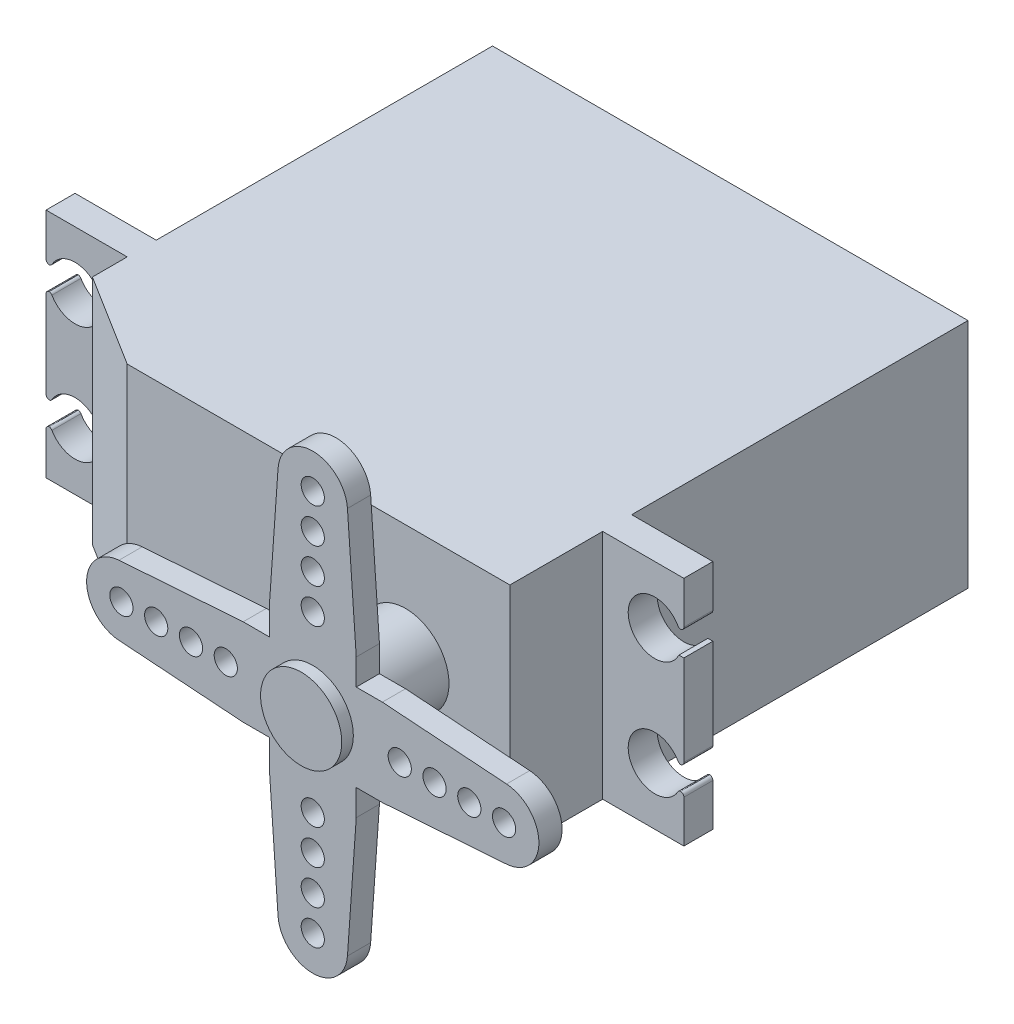
from build123d import *

# Parameters (mm, degrees)
BOSS_EXTRUDE1_DEPTH = 39.5
CHAMFER1_SIZE       = 5
CHAMFER1_SIZE2      = 8
SKETCH2_W           = 7.0000000000000036
SKETCH2_H           = 20
SKETCH2_W_2         = 7
BOSS_EXTRUDE2_DEPTH = 2.5
CUT_EXTRUDE1_REACH  = 44.994
FILLET1_R           = 0.3
SKETCH4_R           = 3.7499999999999996
BOSS_EXTRUDE3_DEPTH = 8
BOSS_EXTRUDE4_START = -2
SKETCH5_R           = 0.9999999999999998
SKETCH5_R_2         = 1.0000000000000016
BOSS_EXTRUDE4_DEPTH = 2
SKETCH6_R           = 3.5
BOSS_EXTRUDE5_DEPTH = 1
FILLET2_R           = 0.3
CUT_EXTRUDE2_REACH  = 61.979
SKETCH7_R           = 0.9999999999999996
SKETCH7_R_2         = 1.0000000000000013
SKETCH7_R_3         = 1.0000000000000016
SKETCH7_R_4         = 0.9999999999999998
SKETCH7_R_5         = 1.0000000000000002


with BuildPart() as part:
    # Sketch1 → Boss-Extrude1 (new body)
    with BuildSketch(Plane.XY):
        Polygon((-20.5, 9.999999999999996), (20.5, 9.999999999999998), (20.499999999999996, -10.000000000000004), (-20.499999999999996, -10.000000000000004), align=None)
    extrude(amount=BOSS_EXTRUDE1_DEPTH)

    # Chamfer1
    chamfer1_edges = [part.edges().sort_by_distance(p)[0] for p in [
        (-20.5, -3.55e-15, 39.5),
    ]]
    chamfer1_side = [part.faces().sort_by_distance(p)[0] for p in [
        (-20.5, -3.57e-15, 19.75),
    ]]
    chamfer(chamfer1_edges, length=CHAMFER1_SIZE, length2=CHAMFER1_SIZE2, reference=chamfer1_side[0])

    # Sketch2 → Boss-Extrude2 (add)
    with BuildSketch(Plane.XY.offset(31.5)):
        with Locations((24, -2.66e-15)):
            Rectangle(SKETCH2_W, SKETCH2_H)
        with Locations((-24.000000000000004, -3.55e-15)):
            Rectangle(SKETCH2_W_2, SKETCH2_H)
    extrude(amount=-BOSS_EXTRUDE2_DEPTH)

    # Sketch3 → Cut-Extrude1 (cut, up to next)
    with BuildSketch(Plane.XY.offset(31.5), mode=Mode.PRIVATE) as cut_extrude1_sk1:
        with BuildLine():
            Line((-25.000000000000004, -7.349999999999999), (-25.000000000000004, -2.749999999999999))
            ThreePointArc((-24.999999999999925, -2.7499999999999996), (-26.22270192606372, -3.1019240261221634), (-27.0712315177208, -4.05))
            Line((-27.0712315177208, -4.050000000000002), (-27.5, -4.05))
            Line((-27.5, -4.05), (-27.5, -6.050000000000002))
            Line((-27.5, -6.050000000000002), (-27.071231517720797, -6.050000000000002))
            ThreePointArc((-27.071231517720797, -6.050000000000001), (-26.222701926063746, -6.998075973877809), (-25.000000000000004, -7.349999999999987))
        make_face()
    cut_extrude1_tool1 = extrude(cut_extrude1_sk1.sketch, amount=-CUT_EXTRUDE1_REACH, mode=Mode.PRIVATE) & part.part
    # Sketch3 → Cut-Extrude1 (cut, up to next)
    with BuildSketch(Plane.XY.offset(31.5), mode=Mode.PRIVATE) as cut_extrude1_sk2:
        with BuildLine():
            Line((-25.000000000000004, 2.750000000000001), (-25.000000000000004, 7.3500000000000005))
            ThreePointArc((-25, 7.3500000000000005), (-26.22270192606375, 6.9980759738778175), (-27.0712315177208, 6.0500000000000025))
            Line((-27.0712315177208, 6.050000000000002), (-27.5, 6.050000000000001))
            Line((-27.5, 6.050000000000001), (-27.5, 4.050000000000001))
            Line((-27.5, 4.050000000000001), (-27.0712315177208, 4.050000000000001))
            ThreePointArc((-27.0712315177208, 4.050000000000001), (-26.22270192606372, 3.1019240261221657), (-24.99999999999993, 2.7500000000000013))
        make_face()
    cut_extrude1_tool2 = extrude(cut_extrude1_sk2.sketch, amount=-CUT_EXTRUDE1_REACH, mode=Mode.PRIVATE) & part.part
    # Sketch3 → Cut-Extrude1 (cut, up to next)
    with BuildSketch(Plane.XY.offset(31.5), mode=Mode.PRIVATE) as cut_extrude1_sk3:
        with BuildLine():
            ThreePointArc((-24.99999999999993, 2.7500000000000013), (-22.700000000000003, 5.050000000000038), (-25, 7.3500000000000005))
            Line((-25.000000000000004, 7.3500000000000005), (-25.000000000000004, 2.750000000000001))
        make_face()
    cut_extrude1_tool3 = extrude(cut_extrude1_sk3.sketch, amount=-CUT_EXTRUDE1_REACH, mode=Mode.PRIVATE) & part.part
    # Sketch3 → Cut-Extrude1 (cut, up to next)
    with BuildSketch(Plane.XY.offset(31.5), mode=Mode.PRIVATE) as cut_extrude1_sk4:
        with BuildLine():
            ThreePointArc((-25.000000000000004, -7.349999999999987), (-22.700000000000014, -5.050000000000032), (-24.999999999999925, -2.7499999999999996))
            Line((-25.000000000000004, -2.749999999999999), (-25.000000000000004, -7.349999999999999))
        make_face()
    cut_extrude1_tool4 = extrude(cut_extrude1_sk4.sketch, amount=-CUT_EXTRUDE1_REACH, mode=Mode.PRIVATE) & part.part
    cut_extrude1_1 = cut_extrude1_tool1.solids().sort_by_distance((-26.061612, -5.05, 31.5))[0]
    add(cut_extrude1_1, mode=Mode.SUBTRACT)
    cut_extrude1_2 = cut_extrude1_tool2.solids().sort_by_distance((-26.061612, 5.05, 31.5))[0]
    add(cut_extrude1_2, mode=Mode.SUBTRACT)
    cut_extrude1_3 = cut_extrude1_tool3.solids().sort_by_distance((-24.02385, 5.05, 31.5))[0]
    add(cut_extrude1_3, mode=Mode.SUBTRACT)
    cut_extrude1_4 = cut_extrude1_tool4.solids().sort_by_distance((-24.02385, -5.05, 31.5))[0]
    add(cut_extrude1_4, mode=Mode.SUBTRACT)
    cut_extrude1 = cut_extrude1_1 + cut_extrude1_2 + cut_extrude1_3 + cut_extrude1_4  # Cut-Extrude1 as one shape, for the pattern or mirror that repeats it

    # Fillet1
    # the kernel refuses this fillet: 0.3 mm, written as the material it takes off along each edge
    with BuildSketch(Plane(origin=(-27.5, -6.050000000000001, 32.25), x_dir=(0, -1, 0), z_dir=(0, 0, -1))) as fillet1_piece_1:
        with BuildLine():
            CenterArc((FILLET1_R, -FILLET1_R), FILLET1_R, 90, 90)
            Line((8.9e-16, -FILLET1_R), (0, 0))
            Line((0, 0), (FILLET1_R, 0))
        make_face()
    extrude(amount=4, mode=Mode.SUBTRACT)
    with BuildSketch(Plane(origin=(-27.071231517720797, -6.050000000000002, 31.951086330296846), x_dir=(-1, 0, 0), z_dir=(0, 0, -1))) as fillet1_piece_2:
        with BuildLine():
            CenterArc((0.1804345321187384, -0.2999999999999998), FILLET1_R, 90, 59.99999999999969)
            ThreePointArc((-0.07937308901659179, -0.14999999999999858), (-0.03830260155452336, -0.07573231884842269), (0, 0))
            Line((0, 0), (0.1804345321187384, 0))
        make_face()
    extrude(amount=3.402172660593692, mode=Mode.SUBTRACT)
    with BuildSketch(Plane(origin=(-27.5, -4.05, 32.25), x_dir=(1, -2.96e-15, 0), z_dir=(0, 0, -1))) as fillet1_piece_3:
        with BuildLine():
            CenterArc((FILLET1_R, -FILLET1_R), FILLET1_R, 89.99999999999983, 90.00000000000017)
            Line((-4.44e-15, -FILLET1_R), (0, 0))
            Line((0, 0), (FILLET1_R, 0))
        make_face()
    extrude(amount=4, mode=Mode.SUBTRACT)
    with BuildSketch(Plane(origin=(-27.071231517720804, -4.050000000000002, 31.951086330296864), x_dir=(0.4677097038471302, 0.8838821374636041, 0), z_dir=(0, 0, -1))) as fillet1_piece_4:
        with BuildLine():
            CenterArc((0.1807736596580287, -0.2997957710755019), FILLET1_R, 92.11426912972495, 59.99999999999976)
            Line((-0.08439098158105073, -0.1594828599213598), (0, 0))
            ThreePointArc((0, 0), (0.08485294228846127, -0.00156575508782813), (0.16970588457692368, -1e-17))
        make_face()
    extrude(amount=3.4021726605937275, mode=Mode.SUBTRACT)
    with BuildSketch(Plane(origin=(-27.5, 6.050000000000001, 32.25), x_dir=(0, 1, 0), z_dir=(0, 0, -1))) as fillet1_piece_5:
        with BuildLine():
            CenterArc((FILLET1_R, FILLET1_R), FILLET1_R, 180, 90)
            Line((8.9e-16, FILLET1_R), (0, 0))
            Line((0, 0), (FILLET1_R, 0))
        make_face()
    extrude(amount=4, mode=Mode.SUBTRACT)
    with BuildSketch(Plane(origin=(-27.0712315177208, 6.050000000000002, 31.951086330296864), x_dir=(0.467709703847141, 0.8838821374635986, 0), z_dir=(0, 0, -1))) as fillet1_piece_6:
        with BuildLine():
            CenterArc((0.18077365965802517, -0.2997957710755002), FILLET1_R, 92.11426912972502, 60.00000000000034)
            Line((-0.0843909815810559, -0.1594828599213611), (0, 0))
            ThreePointArc((0, 0), (0.08485294228846048, -0.00156575508782875), (0.16970588457691976, 1e-17))
        make_face()
    extrude(amount=3.4021726605937275, mode=Mode.SUBTRACT)
    with BuildSketch(Plane(origin=(-27.5, 4.050000000000001, 32.25), x_dir=(0, -1, 0), z_dir=(0, 0, -1))) as fillet1_piece_7:
        with BuildLine():
            CenterArc((FILLET1_R, -FILLET1_R), FILLET1_R, 90, 90)
            Line((0, -FILLET1_R), (0, 0))
            Line((0, 0), (FILLET1_R, 0))
        make_face()
    extrude(amount=4, mode=Mode.SUBTRACT)
    with BuildSketch(Plane(origin=(-27.071231517720808, 4.050000000000001, 31.951086330296874), x_dir=(-1, 0, 0), z_dir=(0, 0, -1))) as fillet1_piece_8:
        with BuildLine():
            CenterArc((0.1804345321187455, -0.2999999999999998), FILLET1_R, 90, 60.00000000000051)
            ThreePointArc((-0.07937308901658824, -0.1500000000000017), (-0.03830260155451981, -0.07573231884842668), (0, 0))
            Line((0, 0), (0.1804345321187455, 0))
        make_face()
    extrude(amount=3.402172660593749, mode=Mode.SUBTRACT)

    # Mirror1: Cut-Extrude1 across plane
    add(cut_extrude1.mirror(Plane(origin=(0, 0, 0), x_dir=(0, 0, 1), z_dir=(1, 0, 0))), mode=Mode.SUBTRACT)

    # Sketch4 → Boss-Extrude3 (add)
    with BuildSketch(Plane.XY.offset(39.5)):
        with Locations((11.500000000000002, 0)):
            Circle(SKETCH4_R)
    extrude(amount=BOSS_EXTRUDE3_DEPTH)

    # Sketch5 → Boss-Extrude4 (add)
    # profile 1 of 10: a face of its own
    with BuildSketch(Plane.XY.offset(47.5).offset(BOSS_EXTRUDE4_START)):
        with BuildLine():
            Line((11.500000000000002, 15.5), (11.500000000000002, 3.75))
            Line((11.500000000000002, 3.75), (15.250000000000002, 3.75))
            Line((15.250000000000002, 3.75), (15.250000000000002, 6.000000000000001))
            Line((15.250000000000002, 6), (14.492527079898673, 16.711616814249528))
            ThreePointArc((14.492527079898675, 16.711616814249528), (13.545134415784378, 18.694863371915048), (11.500000000000002, 19.5))
            Line((11.500000000000002, 19.5), (11.500000000000002, 17.5))
            ThreePointArc((11.500000000000034, 17.5), (12.20710678118656, 17.207106781186535), (12.500000000000002, 16.5))
            ThreePointArc((12.500000000000002, 16.5), (12.207106781186539, 15.792893218813441), (11.499999999999972, 15.5))
        make_face()
    # profile 2 of 10: a face of its own
    with BuildSketch(Plane.XY.offset(47.5).offset(BOSS_EXTRUDE4_START)):
        with BuildLine():
            Line((7.750000000000002, 3.7499999999999996), (11.500000000000002, 3.75))
            Line((11.500000000000002, 3.75), (11.500000000000002, 15.5))
            ThreePointArc((11.499999999999972, 15.5), (10.500000000000002, 16.500000000000032), (11.500000000000034, 17.5))
            Line((11.500000000000002, 17.5), (11.500000000000002, 19.5))
            ThreePointArc((11.500000000000002, 19.5), (9.454865584215625, 18.694863371915048), (8.507472920101328, 16.711616814249528))
            Line((8.50747292010133, 16.711616814249528), (7.750000000000002, 6))
            Line((7.750000000000002, 5.999999999999999), (7.750000000000002, 3.7499999999999996))
        make_face()
    # profile 3 of 10: a face of its own
    with BuildSketch(Plane.XY.offset(47.5).offset(BOSS_EXTRUDE4_START)):
        with BuildLine():
            Line((7.750000000000002, 0), (7.750000000000002, 3.7499999999999996))
            Line((7.750000000000002, 3.7499999999999996), (5.500000000000002, 3.749999999999999))
            Line((5.500000000000002, 3.749999999999999), (-5.211616814249522, 2.9925270798986716))
            ThreePointArc((-5.211616814249523, 2.9925270798986716), (-7.9999999999999964, -1.4e-16), (-5.211616814249525, -2.9925270798986743))
            Line((-5.211616814249524, -2.992527079898674), (5.500000000000002, -3.75))
            Line((5.500000000000002, -3.75), (7.750000000000003, -3.75))
            Line((7.750000000000003, -3.75), (7.750000000000002, 0))
        make_face()
        with Locations((-4.999999999999997, 0)):
            Circle(SKETCH5_R, mode=Mode.SUBTRACT)
    # profile 4 of 10: a face of its own
    with BuildSketch(Plane.XY.offset(47.5).offset(BOSS_EXTRUDE4_START)):
        with BuildLine():
            Line((17.5, 3.75), (15.250000000000002, 3.75))
            Line((15.250000000000002, 3.75), (15.250000000000002, 0))
            Line((15.250000000000002, 0), (15.250000000000002, -3.75))
            Line((15.250000000000002, -3.75), (17.5, -3.75))
            Line((17.5, -3.75), (28.21161681424953, -2.9925270798986747))
            ThreePointArc((28.21161681424953, -2.9925270798986743), (31.000000000000007, 1.1e-16), (28.21161681424953, 2.9925270798986756))
            Line((28.21161681424953, 2.9925270798986747), (17.5, 3.75))
        make_face()
        with Locations((28.000000000000004, 0)):
            Circle(SKETCH5_R_2, mode=Mode.SUBTRACT)
    # profile 5 of 10: a face of its own
    with BuildSketch(Plane.XY.offset(47.5).offset(BOSS_EXTRUDE4_START)):
        with BuildLine():
            Line((15.250000000000002, -3.75), (11.500000000000002, -3.75))
            Line((11.500000000000002, -3.75), (11.500000000000002, -15.5))
            ThreePointArc((11.500000000000034, -15.5), (12.20710678118656, -15.792893218813465), (12.500000000000002, -16.5))
            ThreePointArc((12.500000000000002, -16.5), (12.207106781186539, -17.207106781186557), (11.499999999999972, -17.5))
            Line((11.500000000000002, -17.5), (11.500000000000002, -19.5))
            ThreePointArc((11.500000000000002, -19.5), (13.545134415784378, -18.694863371915048), (14.492527079898677, -16.711616814249528))
            Line((14.492527079898675, -16.711616814249528), (15.250000000000002, -6))
            Line((15.250000000000002, -5.999999999999999), (15.250000000000002, -3.75))
        make_face()
    # profile 6 of 10: a face of its own
    with BuildSketch(Plane.XY.offset(47.5).offset(BOSS_EXTRUDE4_START)):
        with BuildLine():
            Line((11.500000000000002, -15.5), (11.500000000000002, -3.75))
            Line((11.500000000000002, -3.75), (7.750000000000003, -3.75))
            Line((7.750000000000003, -3.75), (7.750000000000003, -6.000000000000001))
            Line((7.750000000000003, -6), (8.507472920101327, -16.711616814249528))
            ThreePointArc((8.507472920101327, -16.711616814249528), (9.454865584215623, -18.694863371915048), (11.500000000000002, -19.5))
            Line((11.500000000000002, -19.5), (11.500000000000002, -17.5))
            ThreePointArc((11.499999999999972, -17.5), (10.500000000000002, -16.499999999999968), (11.500000000000034, -15.5))
        make_face()
    # profile 7 of 10: a face of its own
    with BuildSketch(Plane.XY.offset(47.5).offset(BOSS_EXTRUDE4_START)):
        with BuildLine():
            Line((7.750000000000003, -3.75), (11.500000000000002, -3.75))
            ThreePointArc((11.500000000000002, -3.7499999999999996), (8.848349570550448, -2.651650429449553), (7.750000000000002, 4.6e-16))
            Line((7.750000000000002, 0), (7.750000000000003, -3.75))
        make_face()
    # profile 8 of 10: a face of its own
    with BuildSketch(Plane.XY.offset(47.5).offset(BOSS_EXTRUDE4_START)):
        with BuildLine():
            ThreePointArc((7.750000000000002, 4.6e-16), (8.848349570550448, 2.651650429449553), (11.500000000000002, 3.7499999999999996))
            Line((11.500000000000002, 3.75), (7.750000000000002, 3.7499999999999996))
            Line((7.750000000000002, 3.7499999999999996), (7.750000000000002, 0))
        make_face()
    # profile 9 of 10: a face of its own
    with BuildSketch(Plane.XY.offset(47.5).offset(BOSS_EXTRUDE4_START)):
        with BuildLine():
            Line((15.250000000000002, 3.75), (11.500000000000002, 3.75))
            ThreePointArc((11.500000000000002, 3.7499999999999996), (14.151650429449555, 2.651650429449553), (15.250000000000002, 0))
            Line((15.250000000000002, 0), (15.250000000000002, 3.75))
        make_face()
    # profile 10 of 10: a face of its own
    with BuildSketch(Plane.XY.offset(47.5).offset(BOSS_EXTRUDE4_START)):
        with BuildLine():
            ThreePointArc((15.250000000000002, -9.2e-16), (14.151650429449553, -2.6516504294495533), (11.500000000000002, -3.7499999999999996))
            Line((11.500000000000002, -3.75), (15.250000000000002, -3.75))
            Line((15.250000000000002, -3.75), (15.250000000000002, 0))
        make_face()
    extrude(amount=BOSS_EXTRUDE4_DEPTH)

    # Sketch6 → Boss-Extrude5 (add)
    with BuildSketch(Plane.XY.offset(47.5)):
        with Locations((11.500000000000002, 0)):
            Circle(SKETCH6_R)
    extrude(amount=BOSS_EXTRUDE5_DEPTH)

    # Fillet2
    # the kernel refuses this fillet: 0.3 mm, written as the material it takes off along each edge
    with BuildSketch(Plane(origin=(27.071231517720797, -6.050000000000002, 31.951086330296846), x_dir=(1, 0, 0), z_dir=(0, 0, -1))) as fillet2_piece_1:
        with BuildLine():
            CenterArc((0.1804345321187384, 0.2999999999999998), FILLET2_R, 210.0000000000003, 59.99999999999966)
            ThreePointArc((-0.07937308901659179, 0.14999999999999858), (-0.03830260155452336, 0.07573231884842269), (0, 0))
            Line((0, 0), (0.1804345321187384, 0))
        make_face()
    extrude(amount=3.402172660593692, mode=Mode.SUBTRACT)
    with BuildSketch(Plane(origin=(27.500000000000004, -6.0500000000000025, 32.25000000000001), x_dir=(0, -1, 0), z_dir=(0, 0, -1))) as fillet2_piece_2:
        with BuildLine():
            CenterArc((FILLET2_R, FILLET2_R), FILLET2_R, 180, 90)
            Line((8.9e-16, FILLET2_R), (0, 0))
            Line((0, 0), (FILLET2_R, 0))
        make_face()
    extrude(amount=4.000000000000011, mode=Mode.SUBTRACT)
    with BuildSketch(Plane(origin=(27.071231517720804, -4.050000000000002, 31.951086330296864), x_dir=(-0.4677097038471302, 0.8838821374636041, 0), z_dir=(0, 0, -1))) as fillet2_piece_3:
        with BuildLine():
            CenterArc((0.1807736596580287, 0.2997957710755019), FILLET2_R, 207.8857308702753, 59.99999999999977)
            Line((-0.08439098158105073, 0.1594828599213598), (0, 0))
            ThreePointArc((0, 0), (0.08485294228846127, 0.00156575508782813), (0.16970588457692368, 1e-17))
        make_face()
    extrude(amount=3.4021726605937275, mode=Mode.SUBTRACT)
    with BuildSketch(Plane(origin=(27.500000000000004, -4.05, 32.24999999999999), x_dir=(-1, -2.96e-15, 0), z_dir=(0, 0, -1))) as fillet2_piece_4:
        with BuildLine():
            CenterArc((FILLET2_R, FILLET2_R), FILLET2_R, 180.00000000000034, 89.99999999999983)
            Line((-4.44e-15, FILLET2_R), (0, 0))
            Line((0, 0), (FILLET2_R, 0))
        make_face()
    extrude(amount=3.9999999999999893, mode=Mode.SUBTRACT)
    with BuildSketch(Plane(origin=(27.500000000000004, 6.050000000000001, 32.25), x_dir=(0, 1, 0), z_dir=(0, 0, -1))) as fillet2_piece_5:
        with BuildLine():
            CenterArc((FILLET2_R, -FILLET2_R), FILLET2_R, 90, 90)
            Line((8.9e-16, -FILLET2_R), (0, 0))
            Line((0, 0), (FILLET2_R, 0))
        make_face()
    extrude(amount=4, mode=Mode.SUBTRACT)
    with BuildSketch(Plane(origin=(27.0712315177208, 6.050000000000002, 31.951086330296864), x_dir=(-0.467709703847141, 0.8838821374635986, 0), z_dir=(0, 0, -1))) as fillet2_piece_6:
        with BuildLine():
            CenterArc((0.18077365965802517, 0.2997957710755002), FILLET2_R, 207.88573087027464, 60.00000000000034)
            Line((-0.0843909815810559, 0.1594828599213611), (0, 0))
            ThreePointArc((0, 0), (0.08485294228846048, 0.00156575508782875), (0.16970588457691976, -1e-17))
        make_face()
    extrude(amount=3.4021726605937275, mode=Mode.SUBTRACT)

    # Sketch7 → Cut-Extrude2 (cut, up to next)
    with BuildSketch(Plane.XY.offset(47.5), mode=Mode.PRIVATE) as cut_extrude2_sk1:
        with Locations((11.500000000000002, 13.500000000000002)):
            Circle(SKETCH7_R)
    cut_extrude2_tool1 = extrude(cut_extrude2_sk1.sketch, amount=-CUT_EXTRUDE2_REACH, mode=Mode.PRIVATE) & part.part
    # Sketch7 → Cut-Extrude2 (cut, up to next)
    with BuildSketch(Plane.XY.offset(47.5), mode=Mode.PRIVATE) as cut_extrude2_sk2:
        with Locations((11.500000000000002, 10.500000000000002)):
            Circle(SKETCH7_R)
    cut_extrude2_tool2 = extrude(cut_extrude2_sk2.sketch, amount=-CUT_EXTRUDE2_REACH, mode=Mode.PRIVATE) & part.part
    # Sketch7 → Cut-Extrude2 (cut, up to next)
    with BuildSketch(Plane.XY.offset(47.5), mode=Mode.PRIVATE) as cut_extrude2_sk3:
        with Locations((11.5, 7.5000000000000036)):
            Circle(SKETCH7_R_2)
    cut_extrude2_tool3 = extrude(cut_extrude2_sk3.sketch, amount=-CUT_EXTRUDE2_REACH, mode=Mode.PRIVATE) & part.part
    # Sketch7 → Cut-Extrude2 (cut, up to next)
    with BuildSketch(Plane.XY.offset(47.5), mode=Mode.PRIVATE) as cut_extrude2_sk4:
        with Locations((25.000000000000004, 0)):
            Circle(SKETCH7_R_3)
    cut_extrude2_tool4 = extrude(cut_extrude2_sk4.sketch, amount=-CUT_EXTRUDE2_REACH, mode=Mode.PRIVATE) & part.part
    # Sketch7 → Cut-Extrude2 (cut, up to next)
    with BuildSketch(Plane.XY.offset(47.5), mode=Mode.PRIVATE) as cut_extrude2_sk5:
        with Locations((22.000000000000007, 0)):
            Circle(SKETCH7_R_3)
    cut_extrude2_tool5 = extrude(cut_extrude2_sk5.sketch, amount=-CUT_EXTRUDE2_REACH, mode=Mode.PRIVATE) & part.part
    # Sketch7 → Cut-Extrude2 (cut, up to next)
    with BuildSketch(Plane.XY.offset(47.5), mode=Mode.PRIVATE) as cut_extrude2_sk6:
        with Locations((19.000000000000007, 0)):
            Circle(SKETCH7_R_3)
    cut_extrude2_tool6 = extrude(cut_extrude2_sk6.sketch, amount=-CUT_EXTRUDE2_REACH, mode=Mode.PRIVATE) & part.part
    # Sketch7 → Cut-Extrude2 (cut, up to next)
    with BuildSketch(Plane.XY.offset(47.5), mode=Mode.PRIVATE) as cut_extrude2_sk7:
        with Locations((11.500000000000005, -7.500000000000003)):
            Circle(SKETCH7_R_4)
    cut_extrude2_tool7 = extrude(cut_extrude2_sk7.sketch, amount=-CUT_EXTRUDE2_REACH, mode=Mode.PRIVATE) & part.part
    # Sketch7 → Cut-Extrude2 (cut, up to next)
    with BuildSketch(Plane.XY.offset(47.5), mode=Mode.PRIVATE) as cut_extrude2_sk8:
        with Locations((11.500000000000005, -10.500000000000002)):
            Circle(SKETCH7_R)
    cut_extrude2_tool8 = extrude(cut_extrude2_sk8.sketch, amount=-CUT_EXTRUDE2_REACH, mode=Mode.PRIVATE) & part.part
    # Sketch7 → Cut-Extrude2 (cut, up to next)
    with BuildSketch(Plane.XY.offset(47.5), mode=Mode.PRIVATE) as cut_extrude2_sk9:
        with Locations((11.500000000000005, -13.500000000000002)):
            Circle(SKETCH7_R)
    cut_extrude2_tool9 = extrude(cut_extrude2_sk9.sketch, amount=-CUT_EXTRUDE2_REACH, mode=Mode.PRIVATE) & part.part
    # Sketch7 → Cut-Extrude2 (cut, up to next)
    with BuildSketch(Plane.XY.offset(47.5), mode=Mode.PRIVATE) as cut_extrude2_sk10:
        with Locations((-1.9999999999999973, -1.65e-15)):
            Circle(SKETCH7_R_5)
    cut_extrude2_tool10 = extrude(cut_extrude2_sk10.sketch, amount=-CUT_EXTRUDE2_REACH, mode=Mode.PRIVATE) & part.part
    # Sketch7 → Cut-Extrude2 (cut, up to next)
    with BuildSketch(Plane.XY.offset(47.5), mode=Mode.PRIVATE) as cut_extrude2_sk11:
        with Locations((1.0000000000000027, -3.69e-15)):
            Circle(SKETCH7_R_5)
    cut_extrude2_tool11 = extrude(cut_extrude2_sk11.sketch, amount=-CUT_EXTRUDE2_REACH, mode=Mode.PRIVATE) & part.part
    # Sketch7 → Cut-Extrude2 (cut, up to next)
    with BuildSketch(Plane.XY.offset(47.5), mode=Mode.PRIVATE) as cut_extrude2_sk12:
        with Locations((4.000000000000002, -3.47e-15)):
            Circle(SKETCH7_R_4)
    cut_extrude2_tool12 = extrude(cut_extrude2_sk12.sketch, amount=-CUT_EXTRUDE2_REACH, mode=Mode.PRIVATE) & part.part
    add(cut_extrude2_tool1.solids().sort_by_distance((11.5, 13.5, 47.5))[0], mode=Mode.SUBTRACT)
    add(cut_extrude2_tool2.solids().sort_by_distance((11.5, 10.5, 47.5))[0], mode=Mode.SUBTRACT)
    add(cut_extrude2_tool3.solids().sort_by_distance((11.5, 7.5, 47.5))[0], mode=Mode.SUBTRACT)
    add(cut_extrude2_tool4.solids().sort_by_distance((25, 0, 47.5))[0], mode=Mode.SUBTRACT)
    add(cut_extrude2_tool5.solids().sort_by_distance((22, 0, 47.5))[0], mode=Mode.SUBTRACT)
    add(cut_extrude2_tool6.solids().sort_by_distance((19, 0, 47.5))[0], mode=Mode.SUBTRACT)
    add(cut_extrude2_tool7.solids().sort_by_distance((11.5, -7.5, 47.5))[0], mode=Mode.SUBTRACT)
    add(cut_extrude2_tool8.solids().sort_by_distance((11.5, -10.5, 47.5))[0], mode=Mode.SUBTRACT)
    add(cut_extrude2_tool9.solids().sort_by_distance((11.5, -13.5, 47.5))[0], mode=Mode.SUBTRACT)
    add(cut_extrude2_tool10.solids().sort_by_distance((-2, 0, 47.5))[0], mode=Mode.SUBTRACT)
    add(cut_extrude2_tool11.solids().sort_by_distance((1, 0, 47.5))[0], mode=Mode.SUBTRACT)
    add(cut_extrude2_tool12.solids().sort_by_distance((4, 0, 47.5))[0], mode=Mode.SUBTRACT)


solid = part.part
